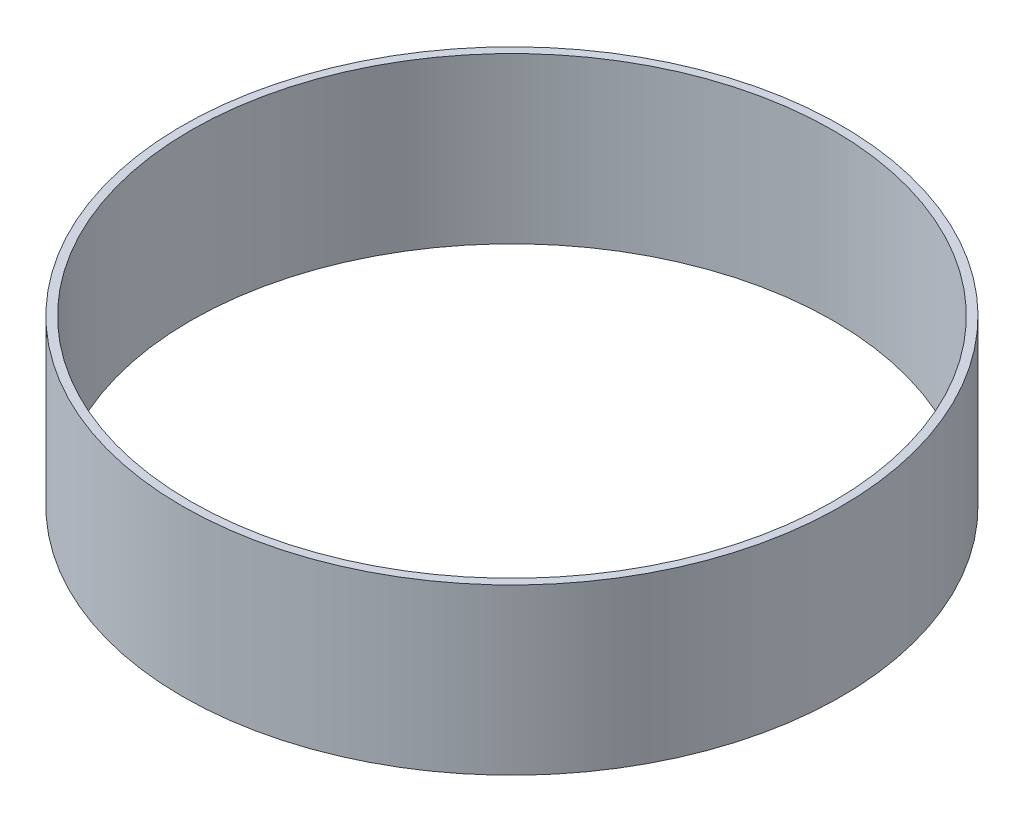
from build123d import *

# Parameters (mm, degrees)
SKETCH1_R           = 50.8
SKETCH1_R_2         = 49.53
BOSS_EXTRUDE1_DEPTH = 25.4


with BuildPart() as part:
    # Sketch1 → Boss-Extrude1 (new body)
    with BuildSketch(Plane(origin=(0, 0, 0), x_dir=(1, 0, 0), z_dir=(0, 1, 0))):
        Circle(SKETCH1_R)
        Circle(SKETCH1_R_2, mode=Mode.SUBTRACT)
    extrude(amount=BOSS_EXTRUDE1_DEPTH)


solid = part.part
